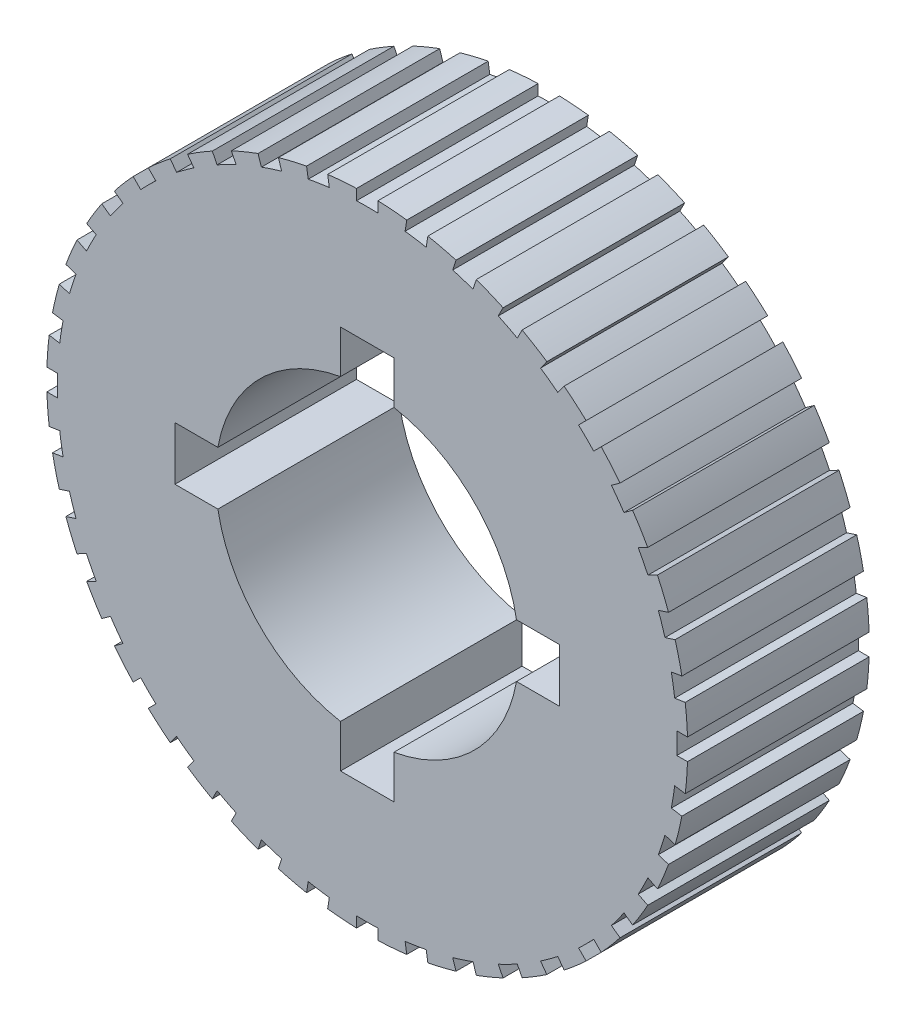
from build123d import *

# Parameters (mm, degrees)
ESBO_O1_R                = 30
ESBO_O1_R_2              = 10.7
RESSALTO_EXTRUS_O1_DEPTH = 30
ESBO_O2_R                = 14.2
ESBO_O2_R_2              = 10.7
CORTE_EXTRUS_O1_DEPTH    = 52.961524227
FILETE2_SIZE             = 2
FILETE2_SIZE_2           = 3
CORTE_EXTRUS_O2_DEPTH    = 52.9615244
CORTE_EXTRUS_O3_DEPTH    = 52.942275826
ESBO_O8_R                = 40
CORTE_EXTRUS_O4_DEPTH    = 6.5
ESBO_O9_R                = 40
CORTE_EXTRUS_O5_DEPTH    = 6.5


with BuildPart() as part:
    # Esboço1 → Ressalto-extrusão1 (new body)
    with BuildSketch(Plane.XY):
        Circle(ESBO_O1_R)
        Circle(ESBO_O1_R_2, mode=Mode.SUBTRACT)
    extrude(amount=RESSALTO_EXTRUS_O1_DEPTH)

    # Esboço2 → Corte-extrusão1 (cut, through all)
    with BuildSketch(Plane(origin=(0, 0, 0), x_dir=(-1, 0, 0), z_dir=(0, 0, -1))):
        Circle(ESBO_O2_R)
        Circle(ESBO_O2_R_2, mode=Mode.SUBTRACT)
    extrude(amount=-CORTE_EXTRUS_O1_DEPTH, mode=Mode.SUBTRACT)

    # Filete2
    # an asymmetric fillet: 3, 2 mm, written as the material it takes off along each edge
    with BuildSketch(Plane(origin=(0, 0, 30), x_dir=(1, 0, 0), z_dir=(0, -1, 0))) as filete2_piece_1:
        with BuildLine():
            Bezier((30, -FILETE2_SIZE), (30, 0), (30 - FILETE2_SIZE_2, 0), weights=[1, 0.707106781, 1])
            Line((30 - FILETE2_SIZE_2, 0), (30, 0))
            Line((30, 0), (30, -FILETE2_SIZE))
        make_face()
    revolve(axis=Axis((0, 0, 30), (0, 0, 1)), mode=Mode.SUBTRACT)
    with BuildSketch(Plane(origin=(0, 0, 0), x_dir=(1, 0, 0), z_dir=(0, -1, 0))) as filete2_piece_2:
        with BuildLine():
            Bezier((30, FILETE2_SIZE_2), (30, 0), (30 - FILETE2_SIZE, 0), weights=[1, 0.707106781, 1])
            Line((30 - FILETE2_SIZE, 0), (30, 0))
            Line((30, 0), (30, FILETE2_SIZE_2))
        make_face()
    revolve(axis=Axis((0, 0, 0), (0, 0, 1)), mode=Mode.SUBTRACT)

    # Esboço6 → Corte-extrusão2 (cut, through all)
    with BuildSketch(Plane.XY.offset(30)):
        with BuildLine():
            Line((5.521589879, 28.469493238), (5.678114326, 29.457749705))
            ThreePointArc((5.678114326, 29.457749705), (4.693033951, 29.630650218), (3.702737645, 29.770618635))
            Line((3.702737645, 29.770618635), (3.546213197, 28.782362168))
            ThreePointArc((3.546213197, 28.782362168), (4.536599486, 28.642961877), (5.521589879, 28.469493238))
        make_face()
        with BuildLine():
            Line((-1, 29.983328701), (-1, 28.982753492))
            ThreePointArc((-1, 28.982753492), (0, 29), (1, 28.982753492))
            Line((1, 28.982753492), (1, 29.983328701))
            ThreePointArc((1, 29.983328701), (0, 30), (-1, 29.983328701))
        make_face()
        with BuildLine():
            Line((9.907219889, 27.255219575), (10.216414633, 28.206823147))
            ThreePointArc((10.216414633, 28.206823147), (9.270509831, 28.531695489), (8.3143016, 28.824857136))
            Line((8.3143016, 28.824857136), (8.005106857, 27.873253563))
            ThreePointArc((8.005106857, 27.873253563), (8.961492837, 27.580638973), (9.907219889, 27.255219575))
        make_face()
        with BuildLine():
            Line((14.048901266, 25.369831951), (14.503152905, 26.26135099))
            ThreePointArc((14.503152905, 26.26135099), (13.619714992, 26.730195726), (12.721139857, 27.169331989))
            Line((12.721139857, 27.169331989), (12.266888218, 26.27781295))
            ThreePointArc((12.266888218, 26.27781295), (13.165724492, 25.839189201), (14.048901266, 25.369831951))
        make_face()
        with BuildLine():
            Line((17.844652068, 22.859754867), (18.43277542, 23.669237215))
            ThreePointArc((18.43277542, 23.669237215), (17.633557569, 24.270509831), (16.814741431, 24.844807719))
            Line((16.814741431, 24.844807719), (16.226618079, 24.035325371))
            ThreePointArc((16.226618079, 24.035325371), (17.045772316, 23.461492837), (17.844652068, 22.859754867))
        make_face()
        with BuildLine():
            Line((21.201008313, 19.786794751), (21.908521828, 20.494308266))
            ThreePointArc((21.908521828, 20.494308266), (21.213203436, 21.213203436), (20.494308266, 21.908521828))
            Line((20.494308266, 21.908521828), (19.786794751, 21.201008313))
            ThreePointArc((19.786794751, 21.201008313), (20.506096654, 20.506096654), (21.201008313, 19.786794751))
        make_face()
        with BuildLine():
            Line((24.035325371, 16.226618079), (24.844807719, 16.814741431))
            ThreePointArc((24.844807719, 16.814741431), (24.270509831, 17.633557569), (23.669237215, 18.43277542))
            Line((23.669237215, 18.43277542), (22.859754867, 17.844652068))
            ThreePointArc((22.859754867, 17.844652068), (23.461492837, 17.045772316), (24.035325371, 16.226618079))
        make_face()
        with BuildLine():
            Line((26.27781295, 12.266888218), (27.169331989, 12.721139857))
            ThreePointArc((27.169331989, 12.721139857), (26.730195726, 13.619714992), (26.26135099, 14.503152905))
            Line((26.26135099, 14.503152905), (25.369831951, 14.048901266))
            ThreePointArc((25.369831951, 14.048901266), (25.839189201, 13.165724492), (26.27781295, 12.266888218))
        make_face()
        with BuildLine():
            Line((27.873253563, 8.005106857), (28.824857136, 8.3143016))
            ThreePointArc((28.824857136, 8.3143016), (28.531695489, 9.270509831), (28.206823147, 10.216414633))
            Line((28.206823147, 10.216414633), (27.255219575, 9.907219889))
            ThreePointArc((27.255219575, 9.907219889), (27.580638973, 8.961492837), (27.873253563, 8.005106857))
        make_face()
        with BuildLine():
            Line((28.782362168, 3.546213197), (29.770618635, 3.702737645))
            ThreePointArc((29.770618635, 3.702737645), (29.630650218, 4.693033951), (29.457749705, 5.678114326))
            Line((29.457749705, 5.678114326), (28.469493238, 5.521589879))
            ThreePointArc((28.469493238, 5.521589879), (28.642961877, 4.536599486), (28.782362168, 3.546213197))
        make_face()
        with BuildLine():
            Line((28.982753492, -1), (29.983328701, -1))
            ThreePointArc((29.983328701, -1), (30, 0), (29.983328701, 1))
            Line((29.983328701, 1), (28.982753492, 1))
            ThreePointArc((28.982753492, 1), (29, 0), (28.982753492, -1))
        make_face()
        with BuildLine():
            Line((28.469493238, -5.521589879), (29.457749705, -5.678114326))
            ThreePointArc((29.457749705, -5.678114326), (29.630650218, -4.693033951), (29.770618635, -3.702737645))
            Line((29.770618635, -3.702737645), (28.782362168, -3.546213197))
            ThreePointArc((28.782362168, -3.546213197), (28.642961877, -4.536599486), (28.469493238, -5.521589879))
        make_face()
        with BuildLine():
            Line((27.255219575, -9.907219889), (28.206823147, -10.216414633))
            ThreePointArc((28.206823147, -10.216414633), (28.531695489, -9.270509831), (28.824857136, -8.3143016))
            Line((28.824857136, -8.3143016), (27.873253563, -8.005106857))
            ThreePointArc((27.873253563, -8.005106857), (27.580638973, -8.961492837), (27.255219575, -9.907219889))
        make_face()
        with BuildLine():
            Line((25.369831951, -14.048901266), (26.26135099, -14.503152905))
            ThreePointArc((26.26135099, -14.503152905), (26.730195726, -13.619714992), (27.169331989, -12.721139857))
            Line((27.169331989, -12.721139857), (26.27781295, -12.266888218))
            ThreePointArc((26.27781295, -12.266888218), (25.839189201, -13.165724492), (25.369831951, -14.048901266))
        make_face()
        with BuildLine():
            Line((22.859754867, -17.844652068), (23.669237215, -18.43277542))
            ThreePointArc((23.669237215, -18.43277542), (24.270509831, -17.633557569), (24.844807719, -16.814741431))
            Line((24.844807719, -16.814741431), (24.035325371, -16.226618079))
            ThreePointArc((24.035325371, -16.226618079), (23.461492837, -17.045772316), (22.859754867, -17.844652068))
        make_face()
        with BuildLine():
            Line((19.786794751, -21.201008313), (20.494308266, -21.908521828))
            ThreePointArc((20.494308266, -21.908521828), (21.213203436, -21.213203436), (21.908521828, -20.494308266))
            Line((21.908521828, -20.494308266), (21.201008313, -19.786794751))
            ThreePointArc((21.201008313, -19.786794751), (20.506096654, -20.506096654), (19.786794751, -21.201008313))
        make_face()
        with BuildLine():
            Line((16.226618079, -24.035325371), (16.814741431, -24.844807719))
            ThreePointArc((16.814741431, -24.844807719), (17.633557569, -24.270509831), (18.43277542, -23.669237215))
            Line((18.43277542, -23.669237215), (17.844652068, -22.859754867))
            ThreePointArc((17.844652068, -22.859754867), (17.045772316, -23.461492837), (16.226618079, -24.035325371))
        make_face()
        with BuildLine():
            Line((12.266888218, -26.27781295), (12.721139857, -27.169331989))
            ThreePointArc((12.721139857, -27.169331989), (13.619714992, -26.730195726), (14.503152905, -26.26135099))
            Line((14.503152905, -26.26135099), (14.048901266, -25.369831951))
            ThreePointArc((14.048901266, -25.369831951), (13.165724492, -25.839189201), (12.266888218, -26.27781295))
        make_face()
        with BuildLine():
            Line((8.005106857, -27.873253563), (8.3143016, -28.824857136))
            ThreePointArc((8.3143016, -28.824857136), (9.270509831, -28.531695489), (10.216414633, -28.206823147))
            Line((10.216414633, -28.206823147), (9.907219889, -27.255219575))
            ThreePointArc((9.907219889, -27.255219575), (8.961492837, -27.580638973), (8.005106857, -27.873253563))
        make_face()
        with BuildLine():
            Line((3.546213197, -28.782362168), (3.702737645, -29.770618635))
            ThreePointArc((3.702737645, -29.770618635), (4.693033951, -29.630650218), (5.678114326, -29.457749705))
            Line((5.678114326, -29.457749705), (5.521589879, -28.469493238))
            ThreePointArc((5.521589879, -28.469493238), (4.536599486, -28.642961877), (3.546213197, -28.782362168))
        make_face()
        with BuildLine():
            Line((-1, -28.982753492), (-1, -29.983328701))
            ThreePointArc((-1, -29.983328701), (0, -30), (1, -29.983328701))
            Line((1, -29.983328701), (1, -28.982753492))
            ThreePointArc((1, -28.982753492), (0, -29), (-1, -28.982753492))
        make_face()
        with BuildLine():
            Line((-5.521589879, -28.469493238), (-5.678114326, -29.457749705))
            ThreePointArc((-5.678114326, -29.457749705), (-4.693033951, -29.630650218), (-3.702737645, -29.770618635))
            Line((-3.702737645, -29.770618635), (-3.546213197, -28.782362168))
            ThreePointArc((-3.546213197, -28.782362168), (-4.536599486, -28.642961877), (-5.521589879, -28.469493238))
        make_face()
        with BuildLine():
            Line((-9.907219889, -27.255219575), (-10.216414633, -28.206823147))
            ThreePointArc((-10.216414633, -28.206823147), (-9.270509831, -28.531695489), (-8.3143016, -28.824857136))
            Line((-8.3143016, -28.824857136), (-8.005106857, -27.873253563))
            ThreePointArc((-8.005106857, -27.873253563), (-8.961492837, -27.580638973), (-9.907219889, -27.255219575))
        make_face()
        with BuildLine():
            Line((-14.048901266, -25.369831951), (-14.503152905, -26.26135099))
            ThreePointArc((-14.503152905, -26.26135099), (-13.619714992, -26.730195726), (-12.721139857, -27.169331989))
            Line((-12.721139857, -27.169331989), (-12.266888218, -26.27781295))
            ThreePointArc((-12.266888218, -26.27781295), (-13.165724492, -25.839189201), (-14.048901266, -25.369831951))
        make_face()
        with BuildLine():
            Line((-17.844652068, -22.859754867), (-18.43277542, -23.669237215))
            ThreePointArc((-18.43277542, -23.669237215), (-17.633557569, -24.270509831), (-16.814741431, -24.844807719))
            Line((-16.814741431, -24.844807719), (-16.226618079, -24.035325371))
            ThreePointArc((-16.226618079, -24.035325371), (-17.045772316, -23.461492837), (-17.844652068, -22.859754867))
        make_face()
        with BuildLine():
            Line((-21.201008313, -19.786794751), (-21.908521828, -20.494308266))
            ThreePointArc((-21.908521828, -20.494308266), (-21.213203436, -21.213203436), (-20.494308266, -21.908521828))
            Line((-20.494308266, -21.908521828), (-19.786794751, -21.201008313))
            ThreePointArc((-19.786794751, -21.201008313), (-20.506096654, -20.506096654), (-21.201008313, -19.786794751))
        make_face()
        with BuildLine():
            Line((-24.035325371, -16.226618079), (-24.844807719, -16.814741431))
            ThreePointArc((-24.844807719, -16.814741431), (-24.270509831, -17.633557569), (-23.669237215, -18.43277542))
            Line((-23.669237215, -18.43277542), (-22.859754867, -17.844652068))
            ThreePointArc((-22.859754867, -17.844652068), (-23.461492837, -17.045772316), (-24.035325371, -16.226618079))
        make_face()
        with BuildLine():
            Line((-26.27781295, -12.266888218), (-27.169331989, -12.721139857))
            ThreePointArc((-27.169331989, -12.721139857), (-26.730195726, -13.619714992), (-26.26135099, -14.503152905))
            Line((-26.26135099, -14.503152905), (-25.369831951, -14.048901266))
            ThreePointArc((-25.369831951, -14.048901266), (-25.839189201, -13.165724492), (-26.27781295, -12.266888218))
        make_face()
        with BuildLine():
            Line((-27.873253563, -8.005106857), (-28.824857136, -8.3143016))
            ThreePointArc((-28.824857136, -8.3143016), (-28.531695489, -9.270509831), (-28.206823147, -10.216414633))
            Line((-28.206823147, -10.216414633), (-27.255219575, -9.907219889))
            ThreePointArc((-27.255219575, -9.907219889), (-27.580638973, -8.961492837), (-27.873253563, -8.005106857))
        make_face()
        with BuildLine():
            Line((-28.782362168, -3.546213197), (-29.770618635, -3.702737645))
            ThreePointArc((-29.770618635, -3.702737645), (-29.630650218, -4.693033951), (-29.457749705, -5.678114326))
            Line((-29.457749705, -5.678114326), (-28.469493238, -5.521589879))
            ThreePointArc((-28.469493238, -5.521589879), (-28.642961877, -4.536599486), (-28.782362168, -3.546213197))
        make_face()
        with BuildLine():
            Line((-28.982753492, 1), (-29.983328701, 1))
            ThreePointArc((-29.983328701, 1), (-30, 0), (-29.983328701, -1))
            Line((-29.983328701, -1), (-28.982753492, -1))
            ThreePointArc((-28.982753492, -1), (-29, 0), (-28.982753492, 1))
        make_face()
        with BuildLine():
            Line((-28.469493238, 5.521589879), (-29.457749705, 5.678114326))
            ThreePointArc((-29.457749705, 5.678114326), (-29.630650218, 4.693033951), (-29.770618635, 3.702737645))
            Line((-29.770618635, 3.702737645), (-28.782362168, 3.546213197))
            ThreePointArc((-28.782362168, 3.546213197), (-28.642961877, 4.536599486), (-28.469493238, 5.521589879))
        make_face()
        with BuildLine():
            Line((-27.255219575, 9.907219889), (-28.206823147, 10.216414633))
            ThreePointArc((-28.206823147, 10.216414633), (-28.531695489, 9.270509831), (-28.824857136, 8.3143016))
            Line((-28.824857136, 8.3143016), (-27.873253563, 8.005106857))
            ThreePointArc((-27.873253563, 8.005106857), (-27.580638973, 8.961492837), (-27.255219575, 9.907219889))
        make_face()
        with BuildLine():
            Line((-25.369831951, 14.048901266), (-26.26135099, 14.503152905))
            ThreePointArc((-26.26135099, 14.503152905), (-26.730195726, 13.619714992), (-27.169331989, 12.721139857))
            Line((-27.169331989, 12.721139857), (-26.27781295, 12.266888218))
            ThreePointArc((-26.27781295, 12.266888218), (-25.839189201, 13.165724492), (-25.369831951, 14.048901266))
        make_face()
        with BuildLine():
            Line((-22.859754867, 17.844652068), (-23.669237215, 18.43277542))
            ThreePointArc((-23.669237215, 18.43277542), (-24.270509831, 17.633557569), (-24.844807719, 16.814741431))
            Line((-24.844807719, 16.814741431), (-24.035325371, 16.226618079))
            ThreePointArc((-24.035325371, 16.226618079), (-23.461492837, 17.045772316), (-22.859754867, 17.844652068))
        make_face()
        with BuildLine():
            Line((-19.786794751, 21.201008313), (-20.494308266, 21.908521828))
            ThreePointArc((-20.494308266, 21.908521828), (-21.213203436, 21.213203436), (-21.908521828, 20.494308266))
            Line((-21.908521828, 20.494308266), (-21.201008313, 19.786794751))
            ThreePointArc((-21.201008313, 19.786794751), (-20.506096654, 20.506096654), (-19.786794751, 21.201008313))
        make_face()
        with BuildLine():
            Line((-16.226618079, 24.035325371), (-16.814741431, 24.844807719))
            ThreePointArc((-16.814741431, 24.844807719), (-17.633557569, 24.270509831), (-18.43277542, 23.669237215))
            Line((-18.43277542, 23.669237215), (-17.844652068, 22.859754867))
            ThreePointArc((-17.844652068, 22.859754867), (-17.045772316, 23.461492837), (-16.226618079, 24.035325371))
        make_face()
        with BuildLine():
            Line((-12.266888218, 26.27781295), (-12.721139857, 27.169331989))
            ThreePointArc((-12.721139857, 27.169331989), (-13.619714992, 26.730195726), (-14.503152905, 26.26135099))
            Line((-14.503152905, 26.26135099), (-14.048901266, 25.369831951))
            ThreePointArc((-14.048901266, 25.369831951), (-13.165724492, 25.839189201), (-12.266888218, 26.27781295))
        make_face()
        with BuildLine():
            Line((-8.005106857, 27.873253563), (-8.3143016, 28.824857136))
            ThreePointArc((-8.3143016, 28.824857136), (-9.270509831, 28.531695489), (-10.216414633, 28.206823147))
            Line((-10.216414633, 28.206823147), (-9.907219889, 27.255219575))
            ThreePointArc((-9.907219889, 27.255219575), (-8.961492837, 27.580638973), (-8.005106857, 27.873253563))
        make_face()
        with BuildLine():
            Line((-3.546213197, 28.782362168), (-3.702737645, 29.770618635))
            ThreePointArc((-3.702737645, 29.770618635), (-4.693033951, 29.630650218), (-5.678114326, 29.457749705))
            Line((-5.678114326, 29.457749705), (-5.521589879, 28.469493238))
            ThreePointArc((-5.521589879, 28.469493238), (-4.536599486, 28.642961877), (-3.546213197, 28.782362168))
        make_face()
    extrude(amount=-CORTE_EXTRUS_O2_DEPTH, mode=Mode.SUBTRACT)

    # Esboço7 → Corte-extrusão3 (cut, through all)
    with BuildSketch(Plane(origin=(0, 0, 0), x_dir=(-1, 0, 0), z_dir=(0, 0, -1))):
        with BuildLine():
            Line((18, 0), (18, 2.5))
            Line((18, 2.5), (13.978197309, 2.5))
            ThreePointArc((13.978197309, 2.5), (14.2, 0), (13.978197309, -2.5))
            Line((13.978197309, -2.5), (18, -2.5))
            Line((18, -2.5), (18, 0))
        make_face()
        with BuildLine():
            Line((0, 18), (-2.5, 18))
            Line((-2.5, 18), (-2.5, 13.978197309))
            ThreePointArc((-2.5, 13.978197309), (0, 14.2), (2.5, 13.978197309))
            Line((2.5, 13.978197309), (2.5, 18))
            Line((2.5, 18), (0, 18))
        make_face()
        with BuildLine():
            Line((2.5, -18), (2.5, -13.978197309))
            ThreePointArc((2.5, -13.978197309), (0, -14.2), (-2.5, -13.978197309))
            Line((-2.5, -13.978197309), (-2.5, -18))
            Line((-2.5, -18), (0, -18))
            Line((0, -18), (2.5, -18))
        make_face()
        with BuildLine():
            Line((-18, -2.5), (-13.978197309, -2.5))
            ThreePointArc((-13.978197309, -2.5), (-14.2, 0), (-13.978197309, 2.5))
            Line((-13.978197309, 2.5), (-18, 2.5))
            Line((-18, 2.5), (-18, 0))
            Line((-18, 0), (-18, -2.5))
        make_face()
    extrude(amount=-CORTE_EXTRUS_O3_DEPTH, mode=Mode.SUBTRACT)

    # Esboço8 → Corte-extrusão4 (cut)
    with BuildSketch(Plane(origin=(0, 0, 0), x_dir=(-1, 0, 0), z_dir=(0, 0, -1))):
        Circle(ESBO_O8_R)
    extrude(amount=-CORTE_EXTRUS_O4_DEPTH, mode=Mode.SUBTRACT)

    # Esboço9 → Corte-extrusão5 (cut)
    with BuildSketch(Plane.XY.offset(30)):
        Circle(ESBO_O9_R)
    extrude(amount=-CORTE_EXTRUS_O5_DEPTH, mode=Mode.SUBTRACT)


solid = part.part
